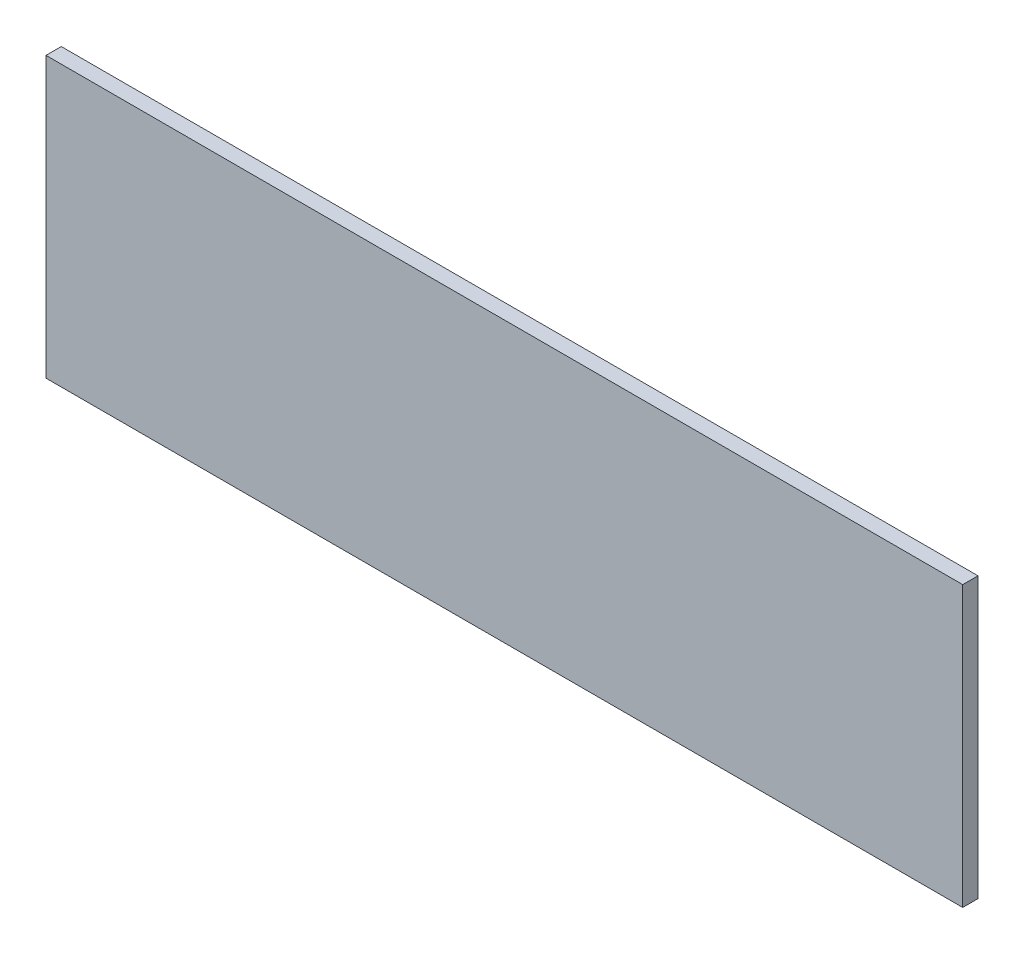
from build123d import *

# Parameters (mm, degrees)
ESQUISSE1_W        = 600
ESQUISSE1_H        = 183
BOSS_EXTRU_1_DEPTH = 10


with BuildPart() as part:
    # Esquisse1 → Boss.-Extru.1 (new body)
    with BuildSketch(Plane.XY):
        with Locations((300, 91.5)):
            Rectangle(ESQUISSE1_W, ESQUISSE1_H)
    extrude(amount=BOSS_EXTRU_1_DEPTH)


solid = part.part
